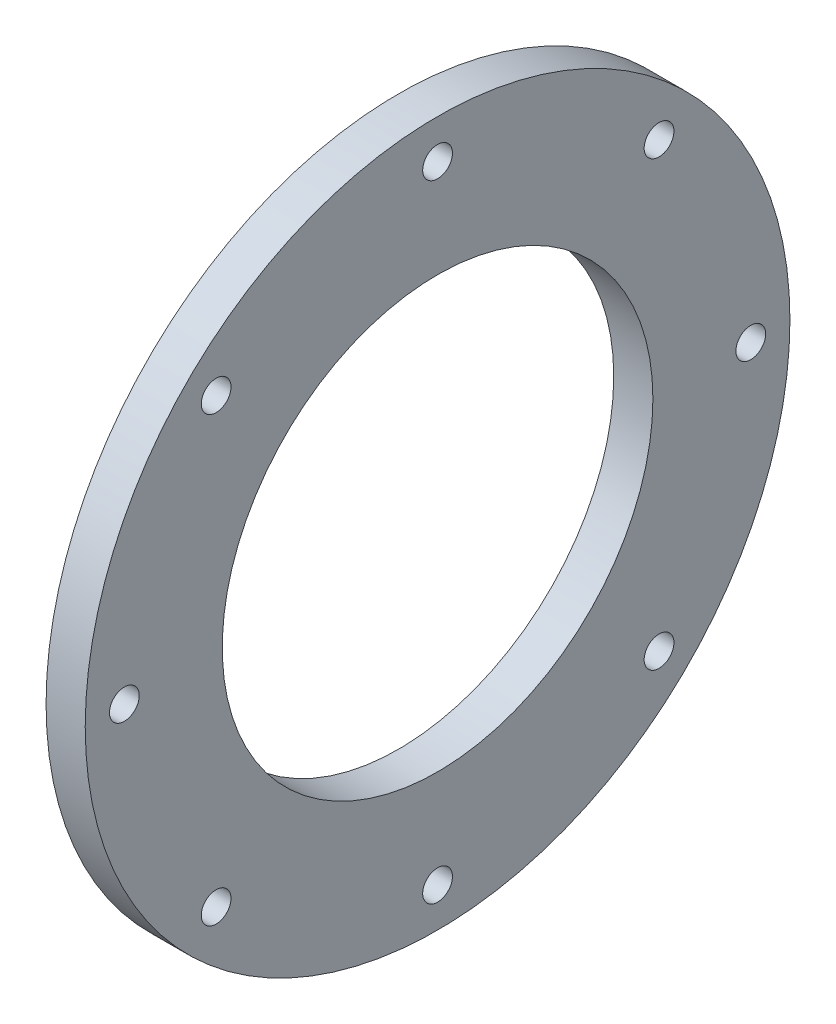
from build123d import *

# Parameters (mm, degrees)
SKETCH1_R           = 57.15
SKETCH1_R_2         = 34.925
BOSS_EXTRUDE1_DEPTH = 6.35
SKETCH2_R           = 2.413
CUT_EXTRUDE1_DEPTH  = 82.071372876


with BuildPart() as part:
    # Sketch1 → Boss-Extrude1 (new body)
    with BuildSketch(Plane(origin=(0, 0, 0), x_dir=(0, 0, -1), z_dir=(1, 0, 0))):
        Circle(SKETCH1_R)
        Circle(SKETCH1_R_2, mode=Mode.SUBTRACT)
    extrude(amount=BOSS_EXTRUDE1_DEPTH)

    # Sketch2 → Cut-Extrude1 (cut, through all)
    with BuildSketch(Plane(origin=(6.35, 0, 0), x_dir=(0, 0, -1), z_dir=(1, 0, 0))):
        with Locations((0, 50.8)):
            Circle(SKETCH2_R)
        with Locations((35.921024484, 35.921024484)):
            Circle(SKETCH2_R)
        with Locations((50.8, 0)):
            Circle(SKETCH2_R)
        with Locations((35.921024484, -35.921024484)):
            Circle(SKETCH2_R)
        with Locations((0, -50.8)):
            Circle(SKETCH2_R)
        with Locations((-35.921024484, -35.921024484)):
            Circle(SKETCH2_R)
        with Locations((-50.8, 0)):
            Circle(SKETCH2_R)
        with Locations((-35.921024484, 35.921024484)):
            Circle(SKETCH2_R)
    extrude(amount=-CUT_EXTRUDE1_DEPTH, mode=Mode.SUBTRACT)


solid = part.part
